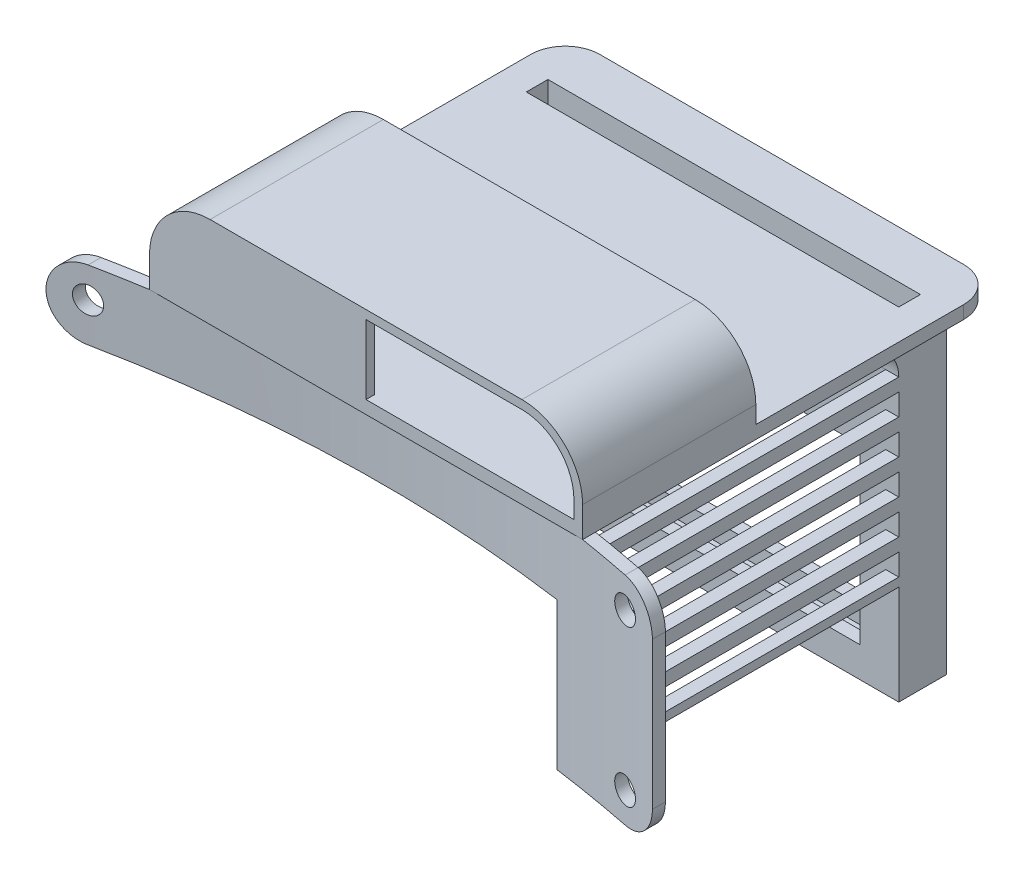
from build123d import *

# Parameters (mm, degrees)
SKETCH_1_W                           = 50
SKETCH_1_H                           = 48
SKETCH_1_W_2                         = 43
SKETCH_1_H_2                         = 2.5
EXTRUDE_1_DEPTH                      = 1.5
SKETCH_2_W                           = 46
SKETCH_2_H                           = 5.5
SKETCH_2_W_2                         = 43
SKETCH_2_H_2                         = 2.5
EXTRUDE_2_DEPTH                      = 35
SKETCH_3_W                           = 46
SKETCH_3_H                           = 5.5
EXTRUDE_3_DEPTH                      = 1.5
SKETCH_4_W                           = 37
SKETCH_4_H                           = 20
CUT_EXTRUDE_1_DEPTH                  = 5.5
EXTRUDE_4_DEPTH                      = 25
SKETCH_6_W                           = 43
SKETCH_6_H                           = 25
SKETCH_6_W_2                         = 35
SKETCH_6_H_2                         = 2.5
EXTRUDE_5_DEPTH                      = 1.5
CUT_EXTRUDE_2_REACH                  = 87.066
CUT_EXTRUDE_2_END_RADIUS             = 158.712724331
SKETCH_7_R                           = 1.5
SKETCH_7_W                           = 56.5
SKETCH_7_H                           = 17
CUT_EXTRUDE_2_DIRECTION_2_REACH      = 87.066
CUT_EXTRUDE_2_DIRECTION_2_END_RADIUS = 157.25
SKETCH_8_W                           = 1
SKETCH_8_H                           = 20
EXTRUDE_6_DEPTH                      = 8
SKETCH_9_W                           = 50
SKETCH_9_H                           = 20
EXTRUDE_7_DEPTH                      = 1
FILLET_1_R                           = 4
FILLET_2_R                           = 6
FILLET_3_R                           = 7


with BuildPart() as part:
    # 草图1 → 凸台-拉伸1 (new body)
    with BuildSketch(Plane(origin=(0, 0, 0), x_dir=(1, 0, 0), z_dir=(0, 1, 0))):
        with Locations((25, 24)):
            Rectangle(SKETCH_1_W, SKETCH_1_H)
        with Locations((25, 41.25)):
            Rectangle(SKETCH_1_W_2, SKETCH_1_H_2, mode=Mode.SUBTRACT)
    extrude(amount=EXTRUDE_1_DEPTH)

    # 草图2 → 凸台-拉伸2 (add)
    with BuildSketch(Plane.XZ):
        with Locations((25, -41.25)):
            Rectangle(SKETCH_2_W, SKETCH_2_H)
        with Locations((25, -41.25)):
            Rectangle(SKETCH_2_W_2, SKETCH_2_H_2, mode=Mode.SUBTRACT)
    extrude(amount=EXTRUDE_2_DEPTH)

    # 草图3 → 凸台-拉伸3 (add)
    with BuildSketch(Plane.XZ.offset(35)):
        with Locations((25, -41.25)):
            Rectangle(SKETCH_3_W, SKETCH_3_H)
    extrude(amount=EXTRUDE_3_DEPTH)

    # 草图4 → 切除-拉伸1 (cut)
    with BuildSketch(Plane(origin=(0, 0, -44), x_dir=(-1, 0, 0), z_dir=(0, 0, -1))):
        with Locations((-25, -23)):
            Rectangle(SKETCH_4_W, SKETCH_4_H)
    extrude(amount=-CUT_EXTRUDE_1_DEPTH, mode=Mode.SUBTRACT)

    # 草图5 → 凸台-拉伸4 (add)
    with BuildSketch(Plane.XZ):
        with BuildLine():
            Line((-10, 0.444545107), (-10, 1.944545107))
            ThreePointArc((-10, 1.944545107), (25, -2), (60, 1.944545107))
            Line((60, 1.944545107), (60, 0.444545107))
            ThreePointArc((60, 0.444545107), (25, -3.462724331), (-10, 0.444545107))
        make_face()
    extrude(amount=EXTRUDE_4_DEPTH)

    # 草图6 → 凸台-拉伸5 (add)
    with BuildSketch(Plane(origin=(48, 0, 0), x_dir=(0, 0, -1), z_dir=(1, 0, 0))):
        with Locations((22.5, -12.5)):
            Rectangle(SKETCH_6_W, SKETCH_6_H)
        with Locations((21, -2.75)):
            Rectangle(SKETCH_6_W_2, SKETCH_6_H_2, mode=Mode.SUBTRACT)
        with Locations((21, -6.75)):
            Rectangle(SKETCH_6_W_2, SKETCH_6_H_2, mode=Mode.SUBTRACT)
        with Locations((21, -10.75)):
            Rectangle(SKETCH_6_W_2, SKETCH_6_H_2, mode=Mode.SUBTRACT)
        with Locations((21, -14.75)):
            Rectangle(SKETCH_6_W_2, SKETCH_6_H_2, mode=Mode.SUBTRACT)
        with Locations((21, -18.75)):
            Rectangle(SKETCH_6_W_2, SKETCH_6_H_2, mode=Mode.SUBTRACT)
        with Locations((21, -22.75)):
            Rectangle(SKETCH_6_W_2, SKETCH_6_H_2, mode=Mode.SUBTRACT)
    extrude(amount=-EXTRUDE_5_DEPTH)

    # 切除-拉伸2: up to this cylinder (the profile starts inside it)
    cut_extrude_2_end = Plane(origin=(25, -12.5, 155.25), z_dir=(0, 1, 0)) * Cylinder(CUT_EXTRUDE_2_END_RADIUS, 510.557448663, mode=Mode.PRIVATE)
    # 草图7 → 切除-拉伸2 (cut, up to the surface)
    with BuildSketch(Plane.XY, mode=Mode.PRIVATE) as cut_extrude_2_sk1:
        with Locations(Location((-6, -3.5, 0), (0, 0, 180))):
            Circle(SKETCH_7_R)
    cut_extrude_2_tool1 = extrude(cut_extrude_2_sk1.sketch, amount=-CUT_EXTRUDE_2_REACH, mode=Mode.PRIVATE) & cut_extrude_2_end
    add(cut_extrude_2_tool1.solids().sort_by_distance((-6, -3.5, 0))[0], mode=Mode.SUBTRACT)
    # 草图7 → 切除-拉伸2 (cut, up to the surface)
    with BuildSketch(Plane.XY, mode=Mode.PRIVATE) as cut_extrude_2_sk2:
        with Locations(Location((56, -3.5, 0), (0, 0, 180))):
            Circle(SKETCH_7_R)
    cut_extrude_2_tool2 = extrude(cut_extrude_2_sk2.sketch, amount=-CUT_EXTRUDE_2_REACH, mode=Mode.PRIVATE) & cut_extrude_2_end
    add(cut_extrude_2_tool2.solids().sort_by_distance((56, -3.5, 0))[0], mode=Mode.SUBTRACT)
    # 草图7 → 切除-拉伸2 (cut, up to the surface)
    with BuildSketch(Plane.XY, mode=Mode.PRIVATE) as cut_extrude_2_sk3:
        with Locations(Location((56, -21.5, 0), (0, 0, 180))):
            Circle(SKETCH_7_R)
    cut_extrude_2_tool3 = extrude(cut_extrude_2_sk3.sketch, amount=-CUT_EXTRUDE_2_REACH, mode=Mode.PRIVATE) & cut_extrude_2_end
    add(cut_extrude_2_tool3.solids().sort_by_distance((56, -21.5, 0))[0], mode=Mode.SUBTRACT)
    # 草图7 → 切除-拉伸2 (cut, up to the surface)
    with BuildSketch(Plane.XY, mode=Mode.PRIVATE) as cut_extrude_2_sk4:
        with Locations((18.25, -16.5)):
            Rectangle(SKETCH_7_W, SKETCH_7_H)
    cut_extrude_2_tool4 = extrude(cut_extrude_2_sk4.sketch, amount=-CUT_EXTRUDE_2_REACH, mode=Mode.PRIVATE) & cut_extrude_2_end
    add(cut_extrude_2_tool4.solids().sort_by_distance((18.25, -16.5, 0))[0], mode=Mode.SUBTRACT)

    # 切除-拉伸2 direction 2: up to this cylinder (the profile starts outside it)
    cut_extrude_2_direction_2_end = Plane(origin=(25, -12.5, 155.25), z_dir=(0, 1, 0)) * Cylinder(CUT_EXTRUDE_2_DIRECTION_2_END_RADIUS, 507.632, mode=Mode.PRIVATE)
    # 草图7 → 切除-拉伸2 direction 2 (cut, up to the surface)
    with BuildSketch(Plane.XY, mode=Mode.PRIVATE) as cut_extrude_2_direction_2_sk1:
        with Locations(Location((-6, -3.5, 0), (0, 0, 180))):
            Circle(SKETCH_7_R)
    cut_extrude_2_direction_2_tool1 = extrude(cut_extrude_2_direction_2_sk1.sketch, amount=CUT_EXTRUDE_2_DIRECTION_2_REACH, mode=Mode.PRIVATE) - cut_extrude_2_direction_2_end
    add(cut_extrude_2_direction_2_tool1.solids().sort_by_distance((-6, -3.5, 0))[0], mode=Mode.SUBTRACT)
    # 草图7 → 切除-拉伸2 direction 2 (cut, up to the surface)
    with BuildSketch(Plane.XY, mode=Mode.PRIVATE) as cut_extrude_2_direction_2_sk2:
        with Locations(Location((56, -3.5, 0), (0, 0, 180))):
            Circle(SKETCH_7_R)
    cut_extrude_2_direction_2_tool2 = extrude(cut_extrude_2_direction_2_sk2.sketch, amount=CUT_EXTRUDE_2_DIRECTION_2_REACH, mode=Mode.PRIVATE) - cut_extrude_2_direction_2_end
    add(cut_extrude_2_direction_2_tool2.solids().sort_by_distance((56, -3.5, 0))[0], mode=Mode.SUBTRACT)
    # 草图7 → 切除-拉伸2 direction 2 (cut, up to the surface)
    with BuildSketch(Plane.XY, mode=Mode.PRIVATE) as cut_extrude_2_direction_2_sk3:
        with Locations(Location((56, -21.5, 0), (0, 0, 180))):
            Circle(SKETCH_7_R)
    cut_extrude_2_direction_2_tool3 = extrude(cut_extrude_2_direction_2_sk3.sketch, amount=CUT_EXTRUDE_2_DIRECTION_2_REACH, mode=Mode.PRIVATE) - cut_extrude_2_direction_2_end
    add(cut_extrude_2_direction_2_tool3.solids().sort_by_distance((56, -21.5, 0))[0], mode=Mode.SUBTRACT)
    # 草图7 → 切除-拉伸2 direction 2 (cut, up to the surface)
    with BuildSketch(Plane.XY, mode=Mode.PRIVATE) as cut_extrude_2_direction_2_sk4:
        with Locations((18.25, -16.5)):
            Rectangle(SKETCH_7_W, SKETCH_7_H)
    cut_extrude_2_direction_2_tool4 = extrude(cut_extrude_2_direction_2_sk4.sketch, amount=CUT_EXTRUDE_2_DIRECTION_2_REACH, mode=Mode.PRIVATE) - cut_extrude_2_direction_2_end
    add(cut_extrude_2_direction_2_tool4.solids().sort_by_distance((18.25, -16.5, 0))[0], mode=Mode.SUBTRACT)

    # 草图8 → 凸台-拉伸6 (add)
    with BuildSketch(Plane(origin=(0, 1.5, 0), x_dir=(1, 0, 0), z_dir=(0, 1, 0))):
        with Locations((49.5, 10)):
            Rectangle(SKETCH_8_W, SKETCH_8_H)
        Polygon((1, 1), (1, 20), (0, 20), (0, 0), (25, 0), (25, 1), align=None)
    extrude(amount=EXTRUDE_6_DEPTH)

    # 草图9 → 凸台-拉伸7 (add)
    with BuildSketch(Plane(origin=(0, 9.5, 0), x_dir=(1, 0, 0), z_dir=(0, 1, 0))):
        with Locations((25, 10)):
            Rectangle(SKETCH_9_W, SKETCH_9_H)
    extrude(amount=EXTRUDE_7_DEPTH)

    # 圆角1
    fillet_1_edges = [part.edges().sort_by_distance(p)[0] for p in [
        (50, 0.75, -48),
        (0, 0.75, -48),
        (-10, 0, 1.194545107),
        (-10, -8, 1.194545107),
        (60, 0, 1.194545107),
        (60, -25, 1.194545107),
        (24.25, 0, -38.5),
        (23.230912683, 0, -3.452864482),
    ]]
    fillet(fillet_1_edges, radius=FILLET_1_R - 0.0001)  # a hair under: the kernel refuses the full size

    # 圆角2
    fillet_2_edges = [part.edges().sort_by_distance(p)[0] for p in [
        (49, 9.5, -10),
        (1, 9.5, -10.5),
    ]]
    fillet(fillet_2_edges, radius=FILLET_2_R)

    # 圆角3
    fillet_3_edges = [part.edges().sort_by_distance(p)[0] for p in [
        (50, 10.5, -10),
        (0, 10.5, -10),
    ]]
    fillet(fillet_3_edges, radius=FILLET_3_R)


solid = part.part
